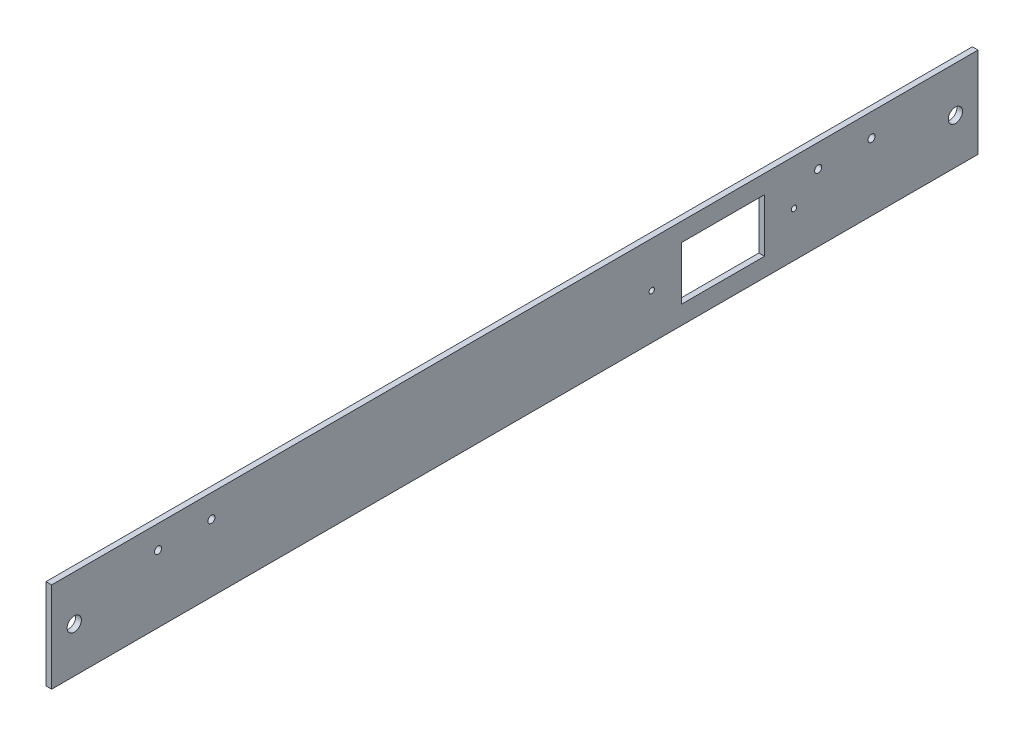
from build123d import *

# Parameters (mm, degrees)
SKETCH1_W                                 = 520.7
SKETCH1_H                                 = 50.8
SKETCH1_R                                 = 4
SKETCH1_R_2                               = 2
BOSS_EXTRUDE2_DEPTH                       = 3.175
ACOUTLETSKETCH2_W                         = 46.8
ACOUTLETSKETCH2_H                         = 30
ACOUTLETCUT_EXTRUDE1_DEPTH                = 524.181814119
POWERCOVERMOUNTINGHOLESSKETCH2_R          = 1.5
POWERCOVERMOUNTINGHOLESCUT_EXTRUDE1_DEPTH = 524.181814119


with BuildPart() as part:
    # Sketch1 → Boss-Extrude2 (new body)
    with BuildSketch(Plane(origin=(0, 0, 0), x_dir=(0, 0, -1), z_dir=(1, 0, 0))):
        with Locations((260.35, 25.4)):
            Rectangle(SKETCH1_W, SKETCH1_H)
        with Locations((12.7, 25.4)):
            Circle(SKETCH1_R, mode=Mode.SUBTRACT)
        with Locations((508, 25.4)):
            Circle(SKETCH1_R, mode=Mode.SUBTRACT)
        with Locations((59.825, 37.8)):
            Circle(SKETCH1_R_2, mode=Mode.SUBTRACT)
        with Locations((89.825, 37.8)):
            Circle(SKETCH1_R_2, mode=Mode.SUBTRACT)
        with Locations((430.875, 37.8)):
            Circle(SKETCH1_R_2, mode=Mode.SUBTRACT)
        with Locations((460.875, 37.8)):
            Circle(SKETCH1_R_2, mode=Mode.SUBTRACT)
    extrude(amount=BOSS_EXTRUDE2_DEPTH)

    # ACOutletSketch2 → ACOutletCut-Extrude1 (cut, through all)
    with BuildSketch(Plane(origin=(3.175, 0, 0), x_dir=(0, 0, -1), z_dir=(1, 0, 0))):
        with Locations((377.3, 25.4)):
            Rectangle(ACOUTLETSKETCH2_W, ACOUTLETSKETCH2_H)
    extrude(amount=-ACOUTLETCUT_EXTRUDE1_DEPTH, mode=Mode.SUBTRACT)

    # PowerCoverMountingHolesSketch2 → PowerCoverMountingHolesCut-Extrude1 (cut, through all)
    with BuildSketch(Plane(origin=(3.175, 0, 0), x_dir=(0, 0, -1), z_dir=(1, 0, 0))):
        with Locations((337.3, 25.4)):
            Circle(POWERCOVERMOUNTINGHOLESSKETCH2_R)
        with Locations((417.3, 25.4)):
            Circle(POWERCOVERMOUNTINGHOLESSKETCH2_R)
    extrude(amount=-POWERCOVERMOUNTINGHOLESCUT_EXTRUDE1_DEPTH, mode=Mode.SUBTRACT)


solid = part.part
